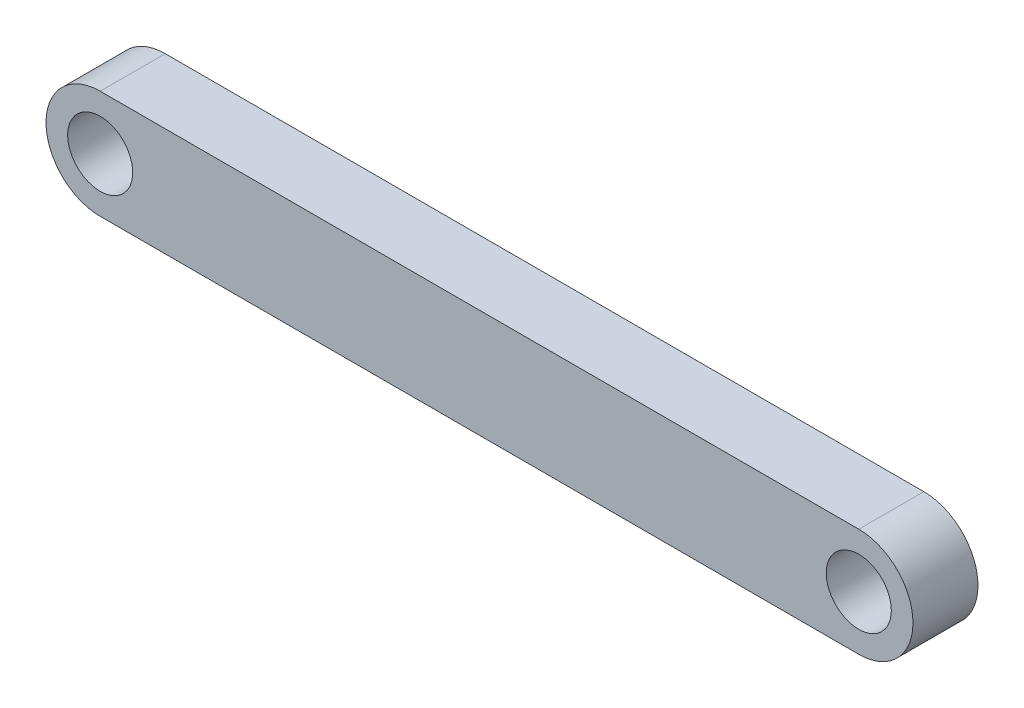
from build123d import *

# Parameters (mm, degrees)
AUFSATZ_LINEAR_AUSTRAGEN1_DEPTH      = 3
AUFSATZ_LINEAR_AUSTRAGEN1_DEPTH_BACK = 3
SKIZZE2_R                            = 3


with BuildPart() as part:
    # Skizze2 → Aufsatz-Linear austragen1 (new, two sides: drawn at the far end of the back side and taken through both)
    with BuildSketch(Plane.XY.offset(-AUFSATZ_LINEAR_AUSTRAGEN1_DEPTH_BACK)):
        with BuildLine():
            Line((0, 685), (70, 685))
            ThreePointArc((70, 685), (75, 680), (70, 675))
            Line((70, 675), (0, 675))
            ThreePointArc((0, 675), (-5, 680), (0, 685))
        make_face()
        with Locations((0, 680)):
            Circle(SKIZZE2_R, mode=Mode.SUBTRACT)
        with Locations((70, 680)):
            Circle(SKIZZE2_R, mode=Mode.SUBTRACT)
    extrude(amount=AUFSATZ_LINEAR_AUSTRAGEN1_DEPTH + AUFSATZ_LINEAR_AUSTRAGEN1_DEPTH_BACK)


solid = part.part
